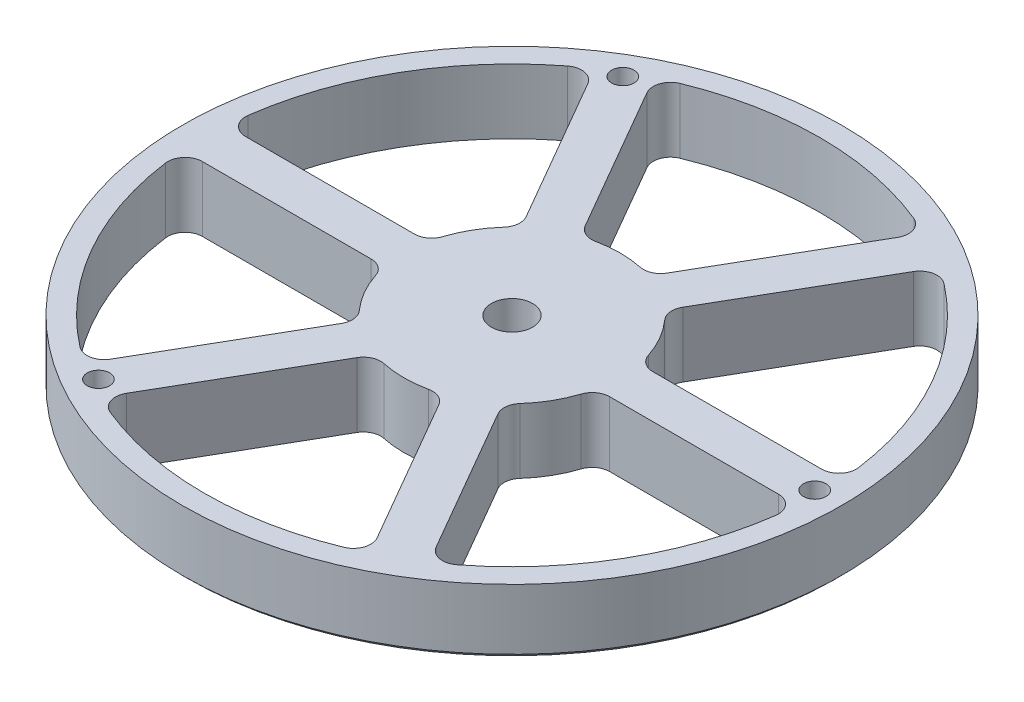
from build123d import *

# Parameters (mm, degrees)
SKETCH2_W                    = 76.2
SKETCH2_H                    = 15
F_6_0_204_DIAMETER_HOLE1_D   = 5.1816
CIRPATTERN3_COUNT            = 3
CUT_EXTRUDE1_DEPTH           = 109.80202204
FILLET1_R                    = 4
CIRPATTERN4_COUNT            = 6
FILLET1_OF_CIRPATTERN4_R     = 4
CHAMFER2_SIZE                = 1
F_3_8_0_375_DIAMETER_HOLE1_D = 9.525


with BuildPart() as part:
    # Sketch2 → Revolve1 (revolve)
    with BuildSketch(Plane(origin=(0, 0, 0), x_dir=(0, 0, -1), z_dir=(1, 0, 0))):
        with Locations((-38.1, 7.5)):
            Rectangle(SKETCH2_W, SKETCH2_H)
    revolve(axis=Axis((0, -0.75, 0), (0, 1, 0)))

    # #6 (0.204) Diameter Hole1 (through all)
    with Locations(Plane(origin=(0, 15, 0), x_dir=(1, 0, 0), z_dir=(0, 1, 0))):
        with Locations((-35, 60.621778265)):
            f_6_0_204_diameter_hole1 = Hole(F_6_0_204_DIAMETER_HOLE1_D / 2)

    # CirPattern3: #6 (0.204) Diameter Hole1 ×3 about axis
    cirpattern3_axis = Axis((0, -0.75, 0), (0, 1, 0))
    for i in range(1, CIRPATTERN3_COUNT):
        add(f_6_0_204_diameter_hole1.rotate(cirpattern3_axis, i * 360 / CIRPATTERN3_COUNT), mode=Mode.SUBTRACT)

    # Sketch8 → Cut-Extrude1 (cut, through all)
    with BuildSketch(Plane(origin=(0, 15, 0), x_dir=(1, 0, 0), z_dir=(0, 1, 0))):
        with BuildLine():
            Line((-7.917321695, 23.713203436), (-31.181983591, 64.008779861))
            ThreePointArc((-31.181983591, 64.008779861), (0, 71.2), (31.181983591, 64.008779861))
            Line((31.181983591, 64.008779861), (7.917321695, 23.713203436))
            ThreePointArc((7.917321695, 23.713203436), (0, 25), (-7.917321695, 23.713203436))
        make_face()
    cut_extrude1 = extrude(amount=-CUT_EXTRUDE1_DEPTH, mode=Mode.SUBTRACT)

    # Fillet1
    fillet1_edges = [part.edges().sort_by_distance(p)[0] for p in [
        (7.917321695, 7.5, -23.713203436),
        (31.181983591, 7.5, -64.008779861),
        (-7.917321695, 7.5, -23.713203436),
        (-31.181983591, 7.5, -64.008779861),
    ]]
    fillet(fillet1_edges, radius=FILLET1_R)

    # CirPattern4: Cut-Extrude1 ×6 about axis
    cirpattern4_axis = Axis((0, -0.75, 0), (0, 1, 0))
    for i in range(1, CIRPATTERN4_COUNT):
        add(cut_extrude1.rotate(cirpattern4_axis, i * 360 / CIRPATTERN4_COUNT), mode=Mode.SUBTRACT)

    # Fillet1 of CirPattern4
    fillet1_of_cirpattern4_edges = [part.edges().sort_by_distance(p)[0] for p in [
        (-16.577575733, 7.5, -18.713203436),
        (-39.842237629, 7.5, -59.008779861),
        (-24.494897428, 7.5, -5),
        (-71.024221221, 7.5, -5),
        (-24.494897428, 7.5, 5),
        (-71.024221221, 7.5, 5),
        (-16.577575733, 7.5, 18.713203436),
        (-39.842237629, 7.5, 59.008779861),
        (-7.917321695, 7.5, 23.713203436),
        (-31.181983591, 7.5, 64.008779861),
        (7.917321695, 7.5, 23.713203436),
        (31.181983591, 7.5, 64.008779861),
        (16.577575733, 7.5, 18.713203436),
        (39.842237629, 7.5, 59.008779861),
        (24.494897428, 7.5, 5),
        (71.024221221, 7.5, 5),
        (24.494897428, 7.5, -5),
        (71.024221221, 7.5, -5),
        (16.577575733, 7.5, -18.713203436),
        (39.842237629, 7.5, -59.008779861),
    ]]
    fillet(fillet1_of_cirpattern4_edges, radius=FILLET1_OF_CIRPATTERN4_R)

    # Chamfer2
    chamfer2_edges = [part.edges().sort_by_distance(p)[0] for p in [
        (0, 0, -76.2),
    ]]
    chamfer(chamfer2_edges, length=CHAMFER2_SIZE)

    # 3/8 (0.375) Diameter Hole1 (through all)
    with Locations(Plane(origin=(0, 0, 0), x_dir=(-1, 0, 0), z_dir=(0, -1, 0))):
        with Locations((0, 0)):
            Hole(F_3_8_0_375_DIAMETER_HOLE1_D / 2)


solid = part.part
